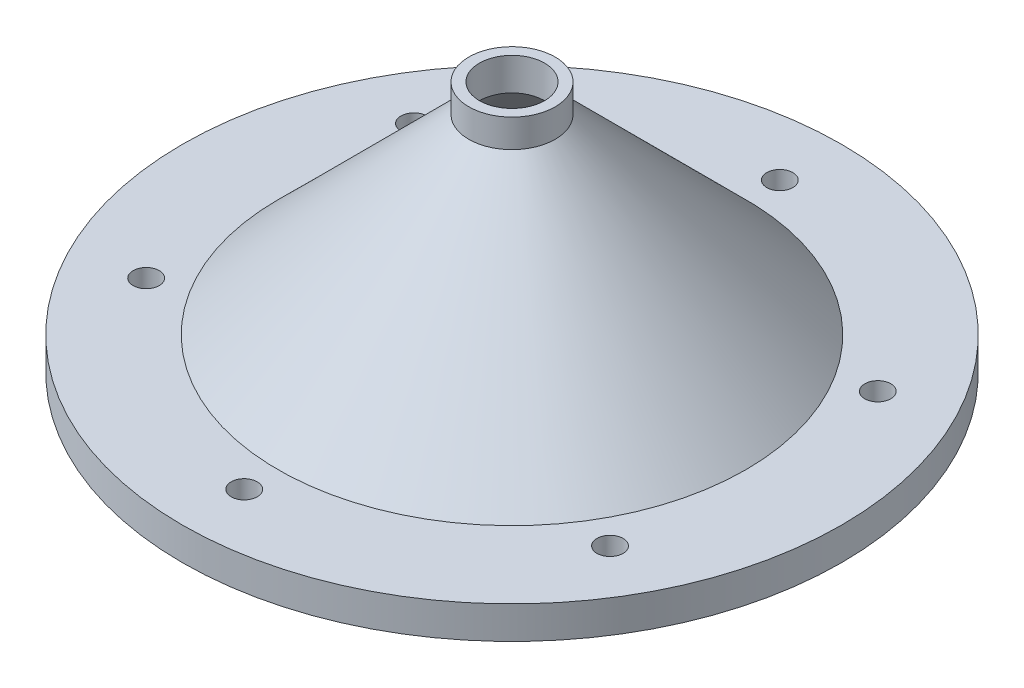
from build123d import *

# Parameters (mm, degrees)
SKETCH3_R          = 4
CUT_EXTRUDE1_DEPTH = 10


with BuildPart() as part:
    # Sketch2 → Revolve1 (revolve)
    with BuildSketch(Plane.XY):
        Polygon((-13.25, 67.546194078), (-71.796194078, 9), (-76.2, 9), (-101.2, 9), (-101.2, -1), (-76.2, -1), (-76.2, 0), (-72.95, 0), (-72.95, -1), (-70.95, -1), (-70.95, 5.25), (-10, 66.2), (-10, 70.796194078), (-10, 76.2), (-13.25, 76.2), align=None)
    revolve(axis=Axis((0, 0, 0), (0, 1, 0)))

    # Sketch3 → Cut-Extrude1 (cut)
    with BuildSketch(Plane.XZ.offset(1)):
        with Locations((0, 82.2)):
            Circle(SKETCH3_R)
        with Locations((71.187288191, 41.1)):
            Circle(SKETCH3_R)
        with Locations((71.187288191, -41.1)):
            Circle(SKETCH3_R)
        with Locations((0, -82.2)):
            Circle(SKETCH3_R)
        with Locations((-71.187288191, -41.1)):
            Circle(SKETCH3_R)
        with Locations((-71.187288191, 41.1)):
            Circle(SKETCH3_R)
    extrude(amount=-CUT_EXTRUDE1_DEPTH, mode=Mode.SUBTRACT)


solid = part.part
